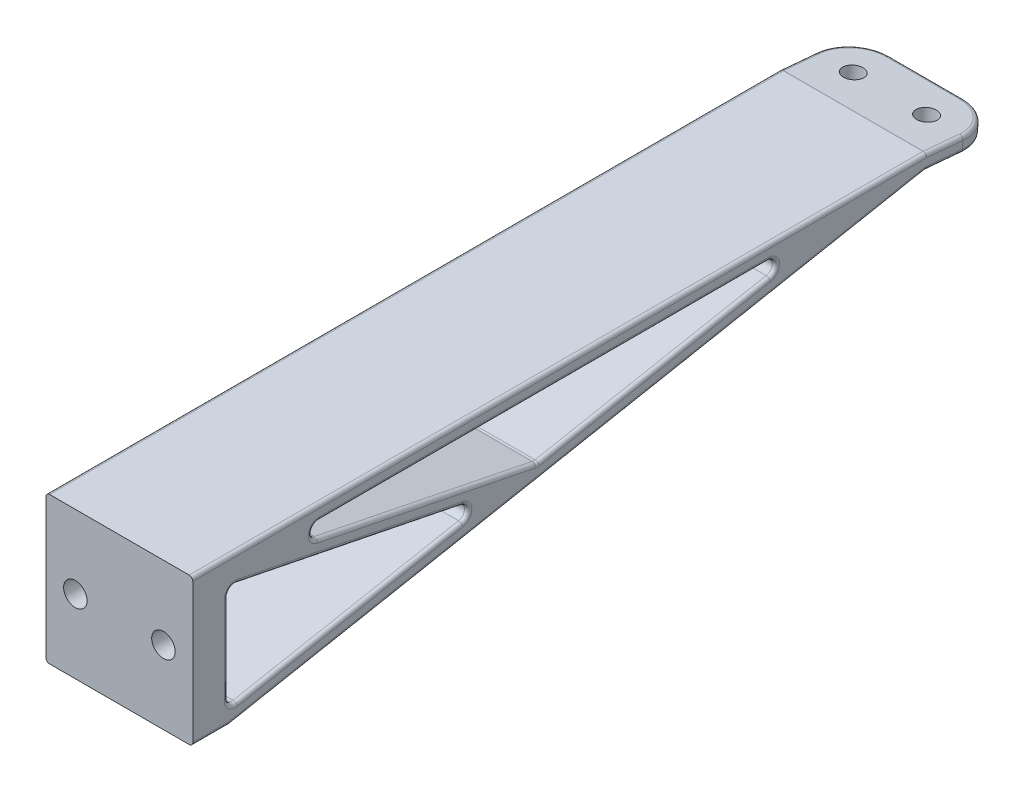
from build123d import *

# Parameters (mm, degrees)
BOSS_EXTRUDE1_DEPTH = 10
FILLET1_R           = 1
SKETCH2_R           = 1.350000000000004
CUT_EXTRUDE1_DEPTH  = 112.63735120832646
FILLET2_R           = 5
FILLET3_R           = 0.5
SKETCH3_R           = 1.6
CUT_EXTRUDE2_DEPTH  = 108.46066783767205
SKETCH3_3_R         = 1.6
CUT_EXTRUDE3_DEPTH  = 1.811779672


with BuildPart() as part:
    # Sketch1 → Boss-Extrude1 (new, symmetric)
    with BuildSketch(Plane(origin=(0, 0, 0), x_dir=(0, 0, -1), z_dir=(1, 0, 0))):
        Polygon((5, 0), (99.82568851450469, 18.00761060381651), (109.78763549542214, 17.136053176339928), (109.96194698091746, 19.128442572523415), (100, 20), (0, 20), (0, 0), align=None)
        Polygon((7.213943781132286, 18.000000000000004), (89.06565708049523, 18.000000000000004), (46.93871837629756, 10), align=None, mode=Mode.SUBTRACT)
        Polygon((4.811779672099927, 2), (4.811779672099926, 16.443608291167273), (41.724774595165265, 9.00986039973272), align=None, mode=Mode.SUBTRACT)
    extrude(amount=BOSS_EXTRUDE1_DEPTH, both=True)

    # Fillet1
    fillet1_edges = [part.edges().sort_by_distance(p)[0] for p in [
        (0, 10, -46.93871837629756),
        (0, 18.000000000000004, -89.06565708049523),
        (0, 18, -7.213943781132289),
        (0, 2, -4.811779672099927),
        (0, 9.009860399732721, -41.72477459516527),
        (0, 16.443608291167273, -4.811779672099927),
    ]]
    fillet(fillet1_edges, radius=FILLET1_R)

    # Sketch2 → Cut-Extrude1 (cut, through all)
    with BuildSketch(Plane(origin=(0, 28.530486413468626, -2.4960941260589085), x_dir=(1, 0, 0), z_dir=(0, 0.9961946980917455, -0.08715574274765775))):
        with Locations(Location((-5.000000000000002, 102.87635495422138, 0), (0, 0, 270))):
            Circle(SKETCH2_R)
        with Locations(Location((4.999999999999998, 102.87635495422138, 0), (0, 0, 270))):
            Circle(SKETCH2_R)
    extrude(amount=-CUT_EXTRUDE1_DEPTH, mode=Mode.SUBTRACT)

    # Fillet2
    fillet2_edges = [part.edges().sort_by_distance(p)[0] for p in [
        (-10, 18.13224787443167, -109.87479123816979),
        (10, 18.13224787443167, -109.87479123816979),
    ]]
    fillet(fillet2_edges, radius=FILLET2_R)

    # Fillet3
    # the kernel refuses this fillet: 0.5 mm, written as the material it adds along each edge
    with BuildSketch(Plane(origin=(-10, 18.00761060381651, -99.82568851450469), x_dir=(0, -0.08715574274767855, -0.9961946980917438), z_dir=(1, 0, 0))) as fillet3_piece_1:
        with BuildLine():
            CenterArc((FILLET3_R * 0.138339535501, -FILLET3_R), FILLET3_R, 90.00000000000139, 15.752560883569203)
            Line((-FILLET3_R * 0.133143931847, -FILLET3_R * 0.0375568967694), (0, 0))
            Line((0, 0), (FILLET3_R * 0.138339535501, 0))
        make_face()
    extrude(amount=20)
    # the kernel refuses this fillet: 0.5 mm, written as the material it takes off along each edge
    with BuildSketch(Plane(origin=(-9.5, 19.5, -99.97816952854573), x_dir=(0, 0.9961946980917455, -0.08715574274765844), z_dir=(-1, 0, 0))) as fillet3_2_piece_1_section:
        Polygon((0, 0), (FILLET3_R, 0), (FILLET3_R, -FILLET3_R * 0.0436609429085), (FILLET3_R * 0.996194698092, -FILLET3_R * 0.0871557427477), align=None)
    fillet3_2_piece_1 = extrude(amount=FILLET3_R, mode=Mode.PRIVATE)
    fillet3_2_piece_1 = fillet3_2_piece_1 - Plane(origin=(-9.5, 19.5, -99.97816952854573), x_dir=(0, -0.9990482215818577, 0.04361938736533613), z_dir=(-1, 0, 0)) * Sphere(FILLET3_R, mode=Mode.PRIVATE)
    add(fillet3_2_piece_1, mode=Mode.SUBTRACT)
    with BuildSketch(Plane(origin=(-9.5, 0.5000000000000001, -4.952944918024983), x_dir=(0, -0.9824420598938401, -0.18656794727805787), z_dir=(-1, 0, 0))) as fillet3_2_piece_2_section:
        Polygon((0, 0), (FILLET3_R, 0), (FILLET3_R, FILLET3_R * 0.09411016395), (FILLET3_R * 0.982442059894, FILLET3_R * 0.186567947278), align=None)
    fillet3_2_piece_2 = extrude(amount=FILLET3_R, mode=Mode.PRIVATE)
    fillet3_2_piece_2 = fillet3_2_piece_2 - Plane(origin=(-9.5, 0.5000000000000001, -4.952944918024983), x_dir=(0, 0.9956008386632266, 0.09369615815539034), z_dir=(-1, 0, 0)) * Sphere(FILLET3_R, mode=Mode.PRIVATE)
    add(fillet3_2_piece_2, mode=Mode.SUBTRACT)
    with BuildSketch(Plane(origin=(9.5, 19.5, -99.97816952854575), x_dir=(0, 0.9961946980917455, -0.08715574274765844), z_dir=(1, 0, 0))) as fillet3_2_piece_3_section:
        Polygon((0, 0), (FILLET3_R, 0), (FILLET3_R, FILLET3_R * 0.0436609429085), (FILLET3_R * 0.996194698092, FILLET3_R * 0.0871557427477), align=None)
    fillet3_2_piece_3 = extrude(amount=FILLET3_R, mode=Mode.PRIVATE)
    fillet3_2_piece_3 = fillet3_2_piece_3 - Plane(origin=(9.5, 19.5, -99.97816952854575), x_dir=(0, -0.9990482215818577, 0.04361938736533613), z_dir=(1, 0, 0)) * Sphere(FILLET3_R, mode=Mode.PRIVATE)
    add(fillet3_2_piece_3, mode=Mode.SUBTRACT)
    with BuildSketch(Plane(origin=(9.5, 0.5, -4.952944918024983), x_dir=(0, -0.9824420598938401, -0.18656794727805787), z_dir=(1, 0, 0))) as fillet3_2_piece_4_section:
        Polygon((0, 0), (FILLET3_R, 0), (FILLET3_R, -FILLET3_R * 0.09411016395), (FILLET3_R * 0.982442059894, -FILLET3_R * 0.186567947278), align=None)
    fillet3_2_piece_4 = extrude(amount=FILLET3_R, mode=Mode.PRIVATE)
    fillet3_2_piece_4 = fillet3_2_piece_4 - Plane(origin=(9.5, 0.5, -4.952944918024983), x_dir=(0, 0.9956008386632266, 0.09369615815539034), z_dir=(1, 0, 0)) * Sphere(FILLET3_R, mode=Mode.PRIVATE)
    add(fillet3_2_piece_4, mode=Mode.SUBTRACT)
    with BuildSketch(Plane(origin=(-10, 20, -99.97816952854573), x_dir=(1, 0, 0), z_dir=(0, 0, 1))) as fillet3_2_piece_5:
        with BuildLine():
            CenterArc((FILLET3_R, -FILLET3_R), FILLET3_R, 90, 90)
            Line((0, -FILLET3_R), (0, 0))
            Line((0, 0), (FILLET3_R, 0))
        make_face()
    extrude(amount=101.22816952854573, mode=Mode.SUBTRACT)
    with BuildSketch(Plane(origin=(-10, 18.001582061332513, -99.89459507040617), x_dir=(1, 0, 0), z_dir=(0, -0.08715574274765822, -0.9961946980917455))) as fillet3_2_piece_6:
        with BuildLine():
            CenterArc((FILLET3_R, -FILLET3_R), FILLET3_R, 90, 90)
            Line((0, -FILLET3_R), (0, 0))
            Line((0, 0), (FILLET3_R, 0))
        make_face()
    extrude(amount=4.930830232249302, mode=Mode.SUBTRACT)
    with BuildSketch(Plane(origin=(-10, 0.00877897005308004, -5.046228891664011), x_dir=(1, -2.3e-16, -4e-17), z_dir=(0, 0.18656794727805787, -0.9824420598938401))) as fillet3_2_piece_7:
        with BuildLine():
            CenterArc((FILLET3_R, -FILLET3_R), FILLET3_R, 89.99999999999999, 90.00000000000001)
            Line((-1.2e-16, -FILLET3_R), (0, 0))
            Line((0, 0), (FILLET3_R, 0))
        make_face()
    extrude(amount=96.40416285105255, mode=Mode.SUBTRACT)
    with BuildSketch(Plane(origin=(-10, 0, 1.25), x_dir=(1, 0, 0), z_dir=(0, 0, -1))) as fillet3_2_piece_8:
        with BuildLine():
            CenterArc((FILLET3_R, -FILLET3_R), FILLET3_R, 90, 90)
            Line((0, -FILLET3_R), (0, 0))
            Line((0, 0), (FILLET3_R, 0))
        make_face()
    extrude(amount=6.202944918024983, mode=Mode.SUBTRACT)
    with BuildSketch(Plane(origin=(9.5, 20, -100), x_dir=(0, -0.08715574274762666, -0.9961946980917483), z_dir=(-1, 0, 0))) as fillet3_2_piece_9:
        with BuildLine():
            CenterArc((FILLET3_R * 0.0436609429085, FILLET3_R), FILLET3_R, 265.0000000000034, 4.999999999998181)
            Line((-FILLET3_R * 0.0434947998391, FILLET3_R * 0.00380530190825), (0, 0))
            Line((0, 0), (FILLET3_R * 0.0436609429085, 0))
        make_face()
    extrude(amount=19, mode=Mode.SUBTRACT)
    with BuildSketch(Plane(origin=(-9.5, 0, -5), x_dir=(0, 0.1865679472780554, -0.9824420598938406), z_dir=(1, 0, 0))) as fillet3_2_piece_10:
        with BuildLine():
            CenterArc((FILLET3_R * 0.09411016395, FILLET3_R), FILLET3_R, 259.24743911643094, 10.752560883569117)
            Line((-FILLET3_R * 0.092457783328, FILLET3_R * 0.0175579401062), (0, 0))
            Line((0, 0), (FILLET3_R * 0.09411016395, 0))
        make_face()
    extrude(amount=19, mode=Mode.SUBTRACT)
    with BuildSketch(Plane(origin=(10, 0, 1.25), x_dir=(0, 1, 0), z_dir=(0, 0, -1))) as fillet3_2_piece_11:
        with BuildLine():
            CenterArc((FILLET3_R, -FILLET3_R), FILLET3_R, 90, 90)
            Line((0, -FILLET3_R), (0, 0))
            Line((0, 0), (FILLET3_R, 0))
        make_face()
    extrude(amount=6.202944918024983, mode=Mode.SUBTRACT)
    with BuildSketch(Plane(origin=(10, 0.00877897005308067, -5.046228891664015), x_dir=(0, 0.9824420598938401, 0.18656794727805787), z_dir=(0, 0.18656794727805787, -0.9824420598938401))) as fillet3_2_piece_12:
        with BuildLine():
            CenterArc((FILLET3_R, -FILLET3_R), FILLET3_R, 90, 90)
            Line((-1.8e-16, -FILLET3_R), (0, 0))
            Line((0, 0), (FILLET3_R, 0))
        make_face()
    extrude(amount=96.40416285105255, mode=Mode.SUBTRACT)
    with BuildSketch(Plane(origin=(-10, 16.017557940106208, -78.62638018777407), x_dir=(1, 0, 0), z_dir=(0, -0.18656794727805784, 0.9824420598938403))) as fillet3_2_piece_13:
        with BuildLine():
            CenterArc((FILLET3_R, -FILLET3_R), FILLET3_R, 90, 90)
            Line((0, -FILLET3_R), (0, 0))
            Line((0, 0), (FILLET3_R, 0))
        make_face()
    extrude(amount=32.05833743733548, mode=Mode.SUBTRACT)
    with BuildSketch(Plane(origin=(10, 16.017557940106208, -78.62638018777407), x_dir=(0, -0.9824420598938401, -0.18656794727805784), z_dir=(0, -0.18656794727805784, 0.9824420598938403))) as fillet3_2_piece_14:
        with BuildLine():
            CenterArc((FILLET3_R, -FILLET3_R), FILLET3_R, 90, 90)
            Line((0, -FILLET3_R), (0, 0))
            Line((0, 0), (FILLET3_R, 0))
        make_face()
    extrude(amount=32.05833743733548, mode=Mode.SUBTRACT)
    with BuildSketch(Plane(origin=(-10, 18.000000000000004, -17.244829523491784), x_dir=(1, 0, 0), z_dir=(0, 0, -1)), Plane(origin=(10, 18.000000000000004, -17.244829523491784), x_dir=(0, 1, 0), z_dir=(0, 0, -1))) as fillet3_2_piece_15:
        with BuildLine():
            CenterArc((FILLET3_R, -FILLET3_R), FILLET3_R, 90, 90)
            Line((0, -FILLET3_R), (0, 0))
            Line((0, 0), (FILLET3_R, 0))
        make_face()
    extrude(amount=61.19498271700424, mode=Mode.SUBTRACT)
    with BuildSketch(Plane(origin=(10, 18.001582061332513, -99.89459507040617), x_dir=(0, 0.9961946980917457, -0.08715574274765824), z_dir=(0, -0.08715574274765822, -0.9961946980917455))) as fillet3_2_piece_16:
        with BuildLine():
            CenterArc((FILLET3_R, -FILLET3_R), FILLET3_R, 90, 90)
            Line((0, -FILLET3_R), (0, 0))
            Line((0, 0), (FILLET3_R, 0))
        make_face()
    extrude(amount=4.930830232249302, mode=Mode.SUBTRACT)
    with BuildSketch(Plane(origin=(-10, 10.038623214121019, -46.746931066910264), x_dir=(1, 0, 0), z_dir=(0, 0.19742210487806974, 0.9803185770480495))) as fillet3_2_piece_17:
        with BuildLine():
            CenterArc((FILLET3_R, -FILLET3_R), FILLET3_R, 90, 90)
            Line((0, -FILLET3_R), (0, 0))
            Line((0, 0), (FILLET3_R, 0))
        make_face()
    extrude(amount=30.29578786288863, mode=Mode.SUBTRACT)
    with BuildSketch(Plane(origin=(10, 10.038623214121019, -46.746931066910264), x_dir=(0, -0.9803185770480495, 0.19742210487806974), z_dir=(0, 0.19742210487806974, 0.9803185770480495))) as fillet3_2_piece_18:
        with BuildLine():
            CenterArc((FILLET3_R, -FILLET3_R), FILLET3_R, 90, 90)
            Line((0, -FILLET3_R), (0, 0))
            Line((0, 0), (FILLET3_R, 0))
        make_face()
    extrude(amount=30.29578786288863, mode=Mode.SUBTRACT)
    with BuildSketch(Plane(origin=(-10, 8.05622053074067, -36.70303355680187), x_dir=(1, 0, 0), z_dir=(0, -0.18656794727805792, 0.9824420598938403))) as fillet3_2_piece_19:
        with BuildLine():
            CenterArc((FILLET3_R, -FILLET3_R), FILLET3_R, 90, 90)
            Line((0, -FILLET3_R), (0, 0))
            Line((0, 0), (FILLET3_R, 0))
        make_face()
    extrude(amount=31.253431821456985, mode=Mode.SUBTRACT)
    with BuildSketch(Plane(origin=(10, 8.05622053074067, -36.70303355680187), x_dir=(0, -0.9824420598938401, -0.18656794727805792), z_dir=(0, -0.18656794727805792, 0.9824420598938403))) as fillet3_2_piece_20:
        with BuildLine():
            CenterArc((FILLET3_R, -FILLET3_R), FILLET3_R, 90, 90)
            Line((0, -FILLET3_R), (0, 0))
            Line((0, 0), (FILLET3_R, 0))
        make_face()
    extrude(amount=31.253431821456985, mode=Mode.SUBTRACT)
    with BuildSketch(Plane(origin=(-10, 16.202464648776655, -6.009201776977991), x_dir=(1, 3.4e-16, -7e-17), z_dir=(0, -0.19742210487806977, -0.9803185770480495))) as fillet3_2_piece_21:
        with BuildLine():
            CenterArc((FILLET3_R, -FILLET3_R), FILLET3_R, 90.00000000000003, 89.99999999999994)
            Line((1.8e-16, -FILLET3_R), (0, 0))
            Line((0, 0), (FILLET3_R, 0))
        make_face()
    extrude(amount=31.321130351199017, mode=Mode.SUBTRACT)
    with BuildSketch(Plane(origin=(10, 16.202464648776655, -6.009201776977991), x_dir=(0, 0.9803185770480494, -0.19742210487806977), z_dir=(0, -0.19742210487806977, -0.9803185770480495))) as fillet3_2_piece_22:
        with BuildLine():
            CenterArc((FILLET3_R, -FILLET3_R), FILLET3_R, 90, 90)
            Line((1.8e-16, -FILLET3_R), (0, 0))
            Line((0, 0), (FILLET3_R, 0))
        make_face()
    extrude(amount=31.321130351199017, mode=Mode.SUBTRACT)
    with BuildSketch(Plane(origin=(-10, 3.2077739703105497, -4.811779672099927), x_dir=(1, 0, 0), z_dir=(0, 1, 6e-17))) as fillet3_2_piece_23:
        with BuildLine():
            CenterArc((FILLET3_R, -FILLET3_R), FILLET3_R, 90, 89.9999999999996)
            Line((0, -FILLET3_R), (0, 0))
            Line((0, 0), (FILLET3_R, 0))
        make_face()
    extrude(amount=12.01437210141806, mode=Mode.SUBTRACT)
    with BuildSketch(Plane(origin=(10, 3.2077739703105497, -4.811779672099927), x_dir=(0, -6e-17, 1), z_dir=(0, 1, 6e-17))) as fillet3_2_piece_24:
        with BuildLine():
            CenterArc((FILLET3_R, -FILLET3_R), FILLET3_R, 90, 90)
            Line((-3.55e-15, -FILLET3_R), (0, 0))
            Line((0, 0), (FILLET3_R, 0))
        make_face()
    extrude(amount=12.01437210141806, mode=Mode.SUBTRACT)
    with BuildSketch(Plane(origin=(-10, 17.000000000000007, -78.43981224049602), x_dir=(0, -0.982442059893839, -0.1865679472780643), z_dir=(0, -0.1865679472780643, 0.982442059893839))) as fillet3_2_piece_25:
        with BuildLine():
            CenterArc((0.9999999999999992 + FILLET3_R, FILLET3_R), FILLET3_R, 180, 89.9999999999996)
            Line((0.9999999999999992 + FILLET3_R, 0), (0.9999999999999992, 0))
            Line((0.9999999999999992, 0), (1.0000000000000029, FILLET3_R))
        make_face()
    revolve(axis=Axis((-10, 17.000000000000007, -78.43981224049602), (1, 0, 0)), revolution_arc=169.24743911643034, mode=Mode.SUBTRACT)
    with BuildSketch(Plane(origin=(10, 17.000000000000007, -78.43981224049602), x_dir=(0, -0.982442059893839, -0.1865679472780643), z_dir=(0, -0.1865679472780643, 0.982442059893839))) as fillet3_2_piece_26:
        with BuildLine():
            CenterArc((0.9999999999999992 + FILLET3_R, -FILLET3_R), FILLET3_R, 90, 90)
            Line((0.9999999999999992, -FILLET3_R), (0.9999999999999992, 0))
            Line((0.9999999999999992, 0), (0.9999999999999992 + FILLET3_R, 0))
        make_face()
    revolve(axis=Axis((10, 17.000000000000007, -78.43981224049602), (1, 0, 0)), revolution_arc=169.24743911643034, mode=Mode.SUBTRACT)
    with BuildSketch(Plane(origin=(-10, 11.018941791169059, -46.944353171788336), x_dir=(0, -0.980318577048049, 0.19742210487807202), z_dir=(0, 0.19742210487807202, 0.980318577048049))) as fillet3_2_piece_27:
        with BuildLine():
            CenterArc((1 + FILLET3_R, FILLET3_R), FILLET3_R, 180, 89.99999999999983)
            Line((1 + FILLET3_R, 0), (1, 0))
            Line((1, 0), (1.0000000000000013, FILLET3_R))
        make_face()
    revolve(axis=Axis((-10, 11.018941791169059, -46.944353171788336), (1, 0, 0)), revolution_arc=22.138811957945123, mode=Mode.SUBTRACT)
    with BuildSketch(Plane(origin=(10, 11.018941791169059, -46.944353171788336), x_dir=(0, -0.980318577048049, 0.19742210487807202), z_dir=(0, 0.19742210487807202, 0.980318577048049))) as fillet3_2_piece_28:
        with BuildLine():
            CenterArc((1 + FILLET3_R, -FILLET3_R), FILLET3_R, 90, 90)
            Line((0.9999999999999997, -FILLET3_R), (1, 0))
            Line((1, 0), (1 + FILLET3_R, 0))
        make_face()
    revolve(axis=Axis((10, 11.018941791169059, -46.944353171788336), (1, 0, 0)), revolution_arc=22.138811957945123, mode=Mode.SUBTRACT)
    with BuildSketch(Plane(origin=(-10, 9.038662590634502, -36.51646560952381), x_dir=(0, 0.9803185770480476, -0.19742210487807918), z_dir=(0, 0.19742210487807918, 0.9803185770480476))) as fillet3_2_piece_29:
        with BuildLine():
            CenterArc((0.9999999999999997 + FILLET3_R, -FILLET3_R), FILLET3_R, 90.00000000000016, 89.99999999999983)
            Line((0.9999999999999997 + FILLET3_R, 0), (0.9999999999999997, 0))
            Line((0.9999999999999997, 0), (1.000000000000001, -FILLET3_R))
        make_face()
    revolve(axis=Axis((-10, 9.038662590634502, -36.51646560952381), (-1, 0, 0)), revolution_arc=157.86118804205444, mode=Mode.SUBTRACT)
    with BuildSketch(Plane(origin=(10, 9.038662590634502, -36.51646560952381), x_dir=(0, 0.9803185770480476, -0.19742210487807918), z_dir=(0, 0.19742210487807918, 0.9803185770480476))) as fillet3_2_piece_30:
        with BuildLine():
            CenterArc((0.9999999999999997 + FILLET3_R, FILLET3_R), FILLET3_R, 180, 90)
            Line((0.9999999999999993, FILLET3_R), (0.9999999999999997, 0))
            Line((0.9999999999999997, 0), (0.9999999999999997 + FILLET3_R, 0))
        make_face()
    revolve(axis=Axis((10, 9.038662590634502, -36.51646560952381), (-1, 0, 0)), revolution_arc=157.86118804205444, mode=Mode.SUBTRACT)
    with BuildSketch(Plane(origin=(-10, 17.000000000000025, -17.244829523491784), x_dir=(0, -0.9803185770480497, 0.1974221048780686), z_dir=(0, -0.1974221048780686, -0.9803185770480497))) as fillet3_2_piece_31:
        with BuildLine():
            CenterArc((0.9999999999999993 + FILLET3_R, -FILLET3_R), FILLET3_R, 90, 90)
            Line((0.9999999999999993 + FILLET3_R, 0), (0.9999999999999993, 0))
            Line((0.9999999999999993, 0), (0.9999999999999993, -FILLET3_R))
        make_face()
    revolve(axis=Axis((-10, 17.000000000000025, -17.244829523491784), (-1, 0, 0)), revolution_arc=168.61374892562438, mode=Mode.SUBTRACT)
    with BuildSketch(Plane(origin=(10, 17.000000000000025, -17.244829523491784), x_dir=(0, -0.9803185770480497, 0.1974221048780686), z_dir=(0, -0.1974221048780686, -0.9803185770480497))) as fillet3_2_piece_32:
        with BuildLine():
            CenterArc((0.9999999999999993 + FILLET3_R, FILLET3_R), FILLET3_R, 180, 90)
            Line((0.9999999999999993, FILLET3_R), (0.9999999999999993, 0))
            Line((0.9999999999999993, 0), (0.9999999999999993 + FILLET3_R, 0))
        make_face()
    revolve(axis=Axis((10, 17.000000000000025, -17.244829523491784), (-1, 0, 0)), revolution_arc=168.61374892562438, mode=Mode.SUBTRACT)
    with BuildSketch(Plane(origin=(-10, 15.22214607172861, -5.811779672099926), x_dir=(0, 0.9803185770480494, -0.1974221048780703), z_dir=(0, -0.1974221048780703, -0.9803185770480494))) as fillet3_2_piece_33:
        with BuildLine():
            CenterArc((0.9999999999999997 + FILLET3_R, FILLET3_R), FILLET3_R, 180, 90)
            Line((0.9999999999999997 + FILLET3_R, 0), (0.9999999999999997, 0))
            Line((0.9999999999999997, 0), (0.9999999999999997, FILLET3_R))
        make_face()
    revolve(axis=Axis((-10, 15.22214607172861, -5.811779672099926), (1, 0, 0)), revolution_arc=101.38625107437593, mode=Mode.SUBTRACT)
    with BuildSketch(Plane(origin=(10, 15.22214607172861, -5.811779672099926), x_dir=(0, 0.9803185770480494, -0.1974221048780703), z_dir=(0, -0.1974221048780703, -0.9803185770480494))) as fillet3_2_piece_34:
        with BuildLine():
            CenterArc((0.9999999999999997 + FILLET3_R, -FILLET3_R), FILLET3_R, 90, 90)
            Line((0.9999999999999997, -FILLET3_R), (0.9999999999999997, 0))
            Line((0.9999999999999997, 0), (0.9999999999999997 + FILLET3_R, 0))
        make_face()
    revolve(axis=Axis((10, 15.22214607172861, -5.811779672099926), (1, 0, 0)), revolution_arc=101.38625107437593, mode=Mode.SUBTRACT)
    with BuildSketch(Plane(origin=(-10, 3.2077739703105497, -5.8117796720999255), x_dir=(0, 0, 1), z_dir=(0, 1, 0))) as fillet3_2_piece_35:
        with BuildLine():
            CenterArc((1 + FILLET3_R, FILLET3_R), FILLET3_R, 180, 90.00000000000023)
            Line((1 + FILLET3_R, 0), (1, 0))
            Line((1, 0), (1, FILLET3_R))
        make_face()
    revolve(axis=Axis((-10, 3.2077739703105497, -5.8117796720999255), (1, 0, 0)), revolution_arc=100.75256088356903, mode=Mode.SUBTRACT)
    with BuildSketch(Plane(origin=(10, 20, -99.97816952854575), x_dir=(0, -1, 0), z_dir=(0, 0, 1))) as fillet3_2_piece_36:
        with BuildLine():
            CenterArc((FILLET3_R, -FILLET3_R), FILLET3_R, 90, 90)
            Line((0, -FILLET3_R), (0, 0))
            Line((0, 0), (FILLET3_R, 0))
        make_face()
    extrude(amount=101.22816952854575, mode=Mode.SUBTRACT)
    with BuildSketch(Plane(origin=(10, 3.2077739703105497, -5.8117796720999255), x_dir=(0, 0, 1), z_dir=(0, 1, 0))) as fillet3_2_piece_37:
        with BuildLine():
            CenterArc((1 + FILLET3_R, -FILLET3_R), FILLET3_R, 90, 90)
            Line((1.0000000000000018, -FILLET3_R), (1, 0))
            Line((1, 0), (1 + FILLET3_R, 0))
        make_face()
    revolve(axis=Axis((10, 3.2077739703105497, -5.8117796720999255), (1, 0, 0)), revolution_arc=100.75256088356903, mode=Mode.SUBTRACT)
    with BuildSketch(Plane(origin=(5.000000000000001, 19.128442572523415, -109.96194698091746), x_dir=(0, 0.08715574274765829, 0.9961946980917454), z_dir=(-1, 0, 0))) as fillet3_2_piece_38:
        with BuildLine():
            CenterArc((FILLET3_R, -FILLET3_R), FILLET3_R, 89.99999999999977, 90.00000000000034)
            Line((1.216e-14, -FILLET3_R), (0, 0))
            Line((0, 0), (FILLET3_R, 0))
        make_face()
    extrude(amount=10, mode=Mode.SUBTRACT)
    with BuildSketch(Plane(origin=(-5.000000000000001, 17.136053176339928, -109.78763549542214), x_dir=(0, 0.08715574274766076, 0.9961946980917453), z_dir=(1, 0, 0))) as fillet3_2_piece_39:
        with BuildLine():
            CenterArc((FILLET3_R, -FILLET3_R), FILLET3_R, 90.00000000000037, 89.99999999999883)
            Line((2.61e-15, -FILLET3_R), (0, 0))
            Line((0, 0), (FILLET3_R, 0))
        make_face()
    extrude(amount=10, mode=Mode.SUBTRACT)
    with BuildSketch(Plane(origin=(-10, 19.564221286261706, -104.98097349045874), x_dir=(1, 0, 0), z_dir=(0, 0.08715574274765844, 0.9961946980917455))) as fillet3_2_piece_40:
        with BuildLine():
            CenterArc((FILLET3_R, -FILLET3_R), FILLET3_R, 90, 90)
            Line((0, -FILLET3_R), (0, 0))
            Line((0, 0), (FILLET3_R, 0))
        make_face()
    extrude(amount=4.978169528545766, mode=Mode.SUBTRACT)
    with BuildSketch(Plane(origin=(10, 19.564221286261706, -104.98097349045874), x_dir=(0, -0.9961946980917454, 0.08715574274765843), z_dir=(0, 0.08715574274765844, 0.9961946980917455))) as fillet3_2_piece_41:
        with BuildLine():
            CenterArc((FILLET3_R, -FILLET3_R), FILLET3_R, 90, 90)
            Line((0, -FILLET3_R), (0, 0))
            Line((0, 0), (FILLET3_R, 0))
        make_face()
    extrude(amount=4.978169528545751, mode=Mode.SUBTRACT)
    with BuildSketch(Plane(origin=(5.000000000000001, 19.564221286261706, -104.98097349045874), x_dir=(1, 0, 0), z_dir=(0, 0.08715574274766183, 0.9961946980917452))) as fillet3_2_piece_42:
        with BuildLine():
            CenterArc((4.999999999999999 - FILLET3_R, -FILLET3_R), FILLET3_R, 0, 90)
            Line((4.999999999999999 - FILLET3_R, -3.54e-15), (4.999999999999999, 0))
            Line((4.999999999999999, 0), (4.999999999999999, -FILLET3_R))
        make_face()
    revolve(axis=Axis((5.000000000000001, 19.564221286261706, -104.98097349045874), (0, 0.9961946980917452, -0.08715574274766183)), revolution_arc=90, mode=Mode.SUBTRACT)
    with BuildSketch(Plane(origin=(-5.000000000000001, 19.564221286261706, -104.98097349045874), x_dir=(0, -0.08715574274766175, -0.9961946980917453), z_dir=(1, 2e-17, 1.8e-16))) as fillet3_2_piece_43:
        with BuildLine():
            CenterArc((4.999999999999997 - FILLET3_R, -FILLET3_R), FILLET3_R, 359.9999999999984, 90.00000000000205)
            Line((4.999999999999987, -FILLET3_R), (4.999999999999997, -3e-17))
            Line((4.999999999999997, -3e-17), (4.999999999999997 - FILLET3_R, 1.591e-14))
        make_face()
    revolve(axis=Axis((-5.000000000000001, 19.564221286261706, -104.98097349045874), (0, 0.9961946980917452, -0.08715574274766183)), revolution_arc=90, mode=Mode.SUBTRACT)
    with BuildSketch(Plane(origin=(5.000000000000001, 17.57183189007822, -104.80666200496341), x_dir=(1, 0, 0), z_dir=(0, 0.08715574274766183, 0.9961946980917452))) as fillet3_2_piece_44:
        with BuildLine():
            CenterArc((4.999999999999999 - FILLET3_R, FILLET3_R), FILLET3_R, 270, 90)
            Line((4.999999999999999, FILLET3_R), (4.999999999999999, 0))
            Line((4.999999999999999, 0), (4.999999999999999 - FILLET3_R, -1.24e-15))
        make_face()
    revolve(axis=Axis((5.000000000000001, 17.57183189007822, -104.80666200496341), (0, 0.9961946980917452, -0.08715574274766183)), revolution_arc=90, mode=Mode.SUBTRACT)
    with BuildSketch(Plane(origin=(-5.000000000000001, 17.57183189007822, -104.80666200496341), x_dir=(0, -0.08715574274766175, -0.9961946980917453), z_dir=(1, 2e-17, 1.8e-16))) as fillet3_2_piece_45:
        with BuildLine():
            CenterArc((4.999999999999997 - FILLET3_R, FILLET3_R), FILLET3_R, 270.0000000000004, 89.99999999999666)
            Line((4.9999999999999805, FILLET3_R), (4.999999999999997, -3e-17))
            Line((4.999999999999997, -3e-17), (4.999999999999997 - FILLET3_R, 1.715e-14))
        make_face()
    revolve(axis=Axis((-5.000000000000001, 17.57183189007822, -104.80666200496341), (0, 0.9961946980917452, -0.08715574274766183)), revolution_arc=90, mode=Mode.SUBTRACT)
    with BuildSketch(Plane(origin=(10, 17.50348471228664, -99.85101719903234), x_dir=(0, 0.996194698091746, -0.08715574274765434), z_dir=(0, -0.08715574274765434, -0.996194698091746))) as fillet3_2_piece_46:
        with BuildLine():
            CenterArc((0.5000000000000016 + FILLET3_R, -FILLET3_R), FILLET3_R, 90, 90)
            Line((0.4999999999999993, -FILLET3_R), (0.5000000000000016, 0))
            Line((0.5000000000000016, 0), (0.5000000000000016 + FILLET3_R, 0))
        make_face()
    revolve(axis=Axis((10, 17.50348471228664, -99.85101719903234), (1, 0, 0)), revolution_arc=15.752560883569192, mode=Mode.SUBTRACT)
    with BuildSketch(Plane(origin=(-10, 17.50348471228664, -99.85101719903234), x_dir=(0, 0.996194698091746, -0.08715574274765434), z_dir=(0, -0.08715574274765434, -0.996194698091746))) as fillet3_2_piece_47:
        with BuildLine():
            CenterArc((0.5000000000000016 + FILLET3_R, FILLET3_R), FILLET3_R, 180, 90.00000000000028)
            Line((0.5000000000000016 + FILLET3_R, 0), (0.5000000000000016, 0))
            Line((0.5000000000000016, 0), (0.4999999999999993, FILLET3_R))
        make_face()
    revolve(axis=Axis((-10, 17.50348471228664, -99.85101719903234), (1, 0, 0)), revolution_arc=15.752560883569192, mode=Mode.SUBTRACT)

    # Sketch3 → Cut-Extrude2 (cut, through all)
    with BuildSketch(Plane(origin=(0, 2.9e-16, -4.811779672099927), x_dir=(-1, 0, 0), z_dir=(0, 1.2e-16, -1))):
        with Locations(Location((-5.9999999999999485, 10, 0), (0, 0, 90))):
            Circle(SKETCH3_R)
        with Locations(Location((6.000000000000052, 10.000000000000002, 0), (0, 0, 90))):
            Circle(SKETCH3_R)
    extrude(amount=-CUT_EXTRUDE2_DEPTH, mode=Mode.SUBTRACT)

    # Sketch3<3> → Cut-Extrude3 (cut)
    # profile 1 of 2: a face of its own
    with BuildSketch(Plane(origin=(0, 2.9e-16, -4.811779672099927), x_dir=(-1, 0, 0), z_dir=(0, 1.2e-16, -1))):
        Polygon((-8.999999999999945, 8.267949192431123), (-5.999999999999947, 6.5358983848622465), (-2.999999999999947, 8.267949192431123), (-2.9999999999999463, 11.732050807568875), (-5.999999999999947, 13.464101615137752), (-8.999999999999945, 11.732050807568873), align=None)
        with Locations(Location((-5.9999999999999485, 10, 0), (0, 0, 90))):
            Circle(SKETCH3_3_R, mode=Mode.SUBTRACT)
    # profile 2 of 2: a face of its own
    with BuildSketch(Plane(origin=(0, 2.9e-16, -4.811779672099927), x_dir=(-1, 0, 0), z_dir=(0, 1.2e-16, -1))):
        Polygon((6.000000000000052, 6.535898384862248), (9.000000000000053, 8.267949192431127), (9.000000000000053, 11.73205080756888), (6.0000000000000515, 13.464101615137757), (3.000000000000053, 11.732050807568875), (3.0000000000000537, 8.267949192431125), align=None)
        with Locations(Location((6.000000000000052, 10.000000000000002, 0), (0, 0, 90))):
            Circle(SKETCH3_3_R, mode=Mode.SUBTRACT)
    extrude(amount=-CUT_EXTRUDE3_DEPTH, mode=Mode.SUBTRACT)


solid = part.part
